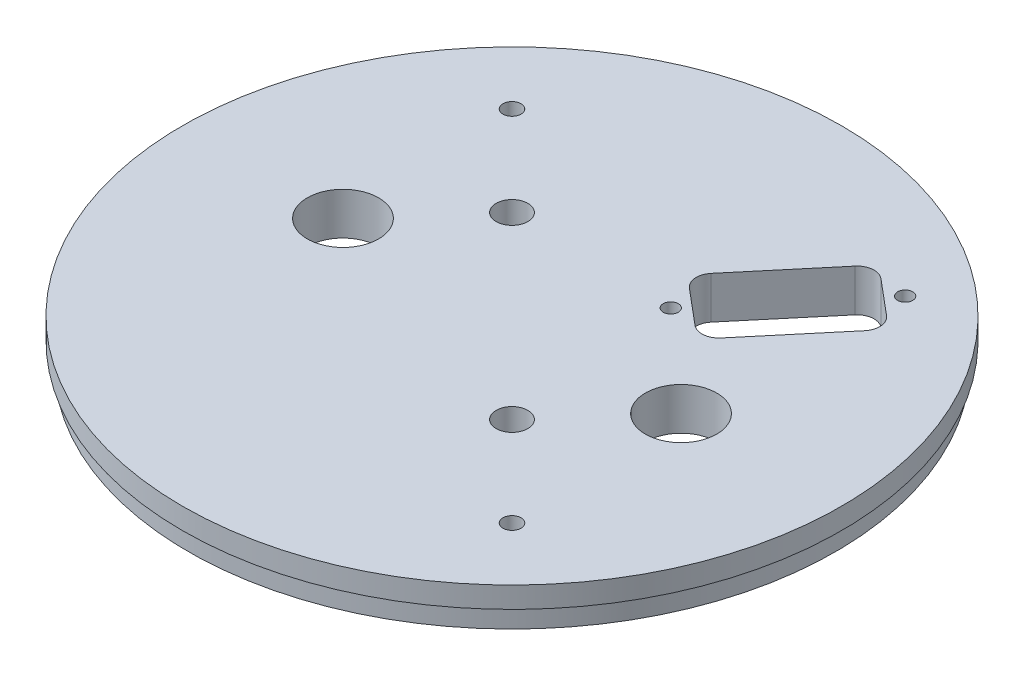
from build123d import *

# Parameters (mm, degrees)
SKETCH1_R                 = 49.5173
SKETCH1_R_2               = 5.3578125
SKETCH1_R_3               = 1.3589
SKETCH1_R_4               = 2.38125
BOSS_EXTRUDE1_DEPTH       = 6.35
SKETCH2_R                 = 49.5173
SKETCH2_R_2               = 48.641
CUT_EXTRUDE1_DEPTH        = 3.175
CUT_EXTRUDE2_START        = -5.969
CUT_EXTRUDE2_DEPTH        = 3.556
TAP_DRILL_FOR_4_40_TAP1_D = 2.2606
CUT_EXTRUDE3_DEPTH        = 71.315350377


with BuildPart() as part:
    # Sketch1 → Boss-Extrude1 (new body)
    with BuildSketch(Plane(origin=(0, 0, 0), x_dir=(1, 0, 0), z_dir=(0, 1, 0))):
        Circle(SKETCH1_R)
        with Locations((25.4, 0)):
            Circle(SKETCH1_R_2, mode=Mode.SUBTRACT)
        with Locations((-25.4, 0)):
            Circle(SKETCH1_R_2, mode=Mode.SUBTRACT)
        with Locations((-26.940768363, 26.940768363)):
            Circle(SKETCH1_R_3, mode=Mode.SUBTRACT)
        with Locations((26.940768363, -26.940768363)):
            Circle(SKETCH1_R_3, mode=Mode.SUBTRACT)
        with Locations((-13.470384182, 13.470384182)):
            Circle(SKETCH1_R_4, mode=Mode.SUBTRACT)
        with Locations((13.470384182, -13.470384182)):
            Circle(SKETCH1_R_4, mode=Mode.SUBTRACT)
    extrude(amount=BOSS_EXTRUDE1_DEPTH)

    # Sketch2 → Cut-Extrude1 (cut)
    with BuildSketch(Plane.XZ):
        Circle(SKETCH2_R)
        Circle(SKETCH2_R_2, mode=Mode.SUBTRACT)
    extrude(amount=-CUT_EXTRUDE1_DEPTH, mode=Mode.SUBTRACT)

    # Sketch3 → Cut-Extrude2 (cut)
    with BuildSketch(Plane(origin=(0, 6.35, 0), x_dir=(1, 0, 0), z_dir=(0, 1, 0)).offset(CUT_EXTRUDE2_START)):
        with BuildLine():
            Line((3.2385, 34.798), (3.2385, 13.97))
            ThreePointArc((3.2385, 13.97), (0, 10.7315), (-3.2385, 13.97))
            Line((-3.2385, 13.97), (-3.2385, 34.798))
            ThreePointArc((-3.2385, 34.798), (0, 38.0365), (3.2385, 34.798))
        make_face()
        with BuildLine():
            Line((3.2385, -34.798), (3.2385, -13.97))
            ThreePointArc((3.2385, -13.97), (0, -10.7315), (-3.2385, -13.97))
            Line((-3.2385, -13.97), (-3.2385, -34.798))
            ThreePointArc((-3.2385, -34.798), (0, -38.0365), (3.2385, -34.798))
        make_face()
    extrude(amount=-CUT_EXTRUDE2_DEPTH, mode=Mode.SUBTRACT)

    # Tap Drill for #4-40 Tap1 (through all)
    with Locations(Plane(origin=(0, 6.35, 0), x_dir=(1, 0, 0), z_dir=(0, 1, 0))):
        with Locations((10.884536857, 12.971685903), (26.954227124, 32.122797011)):
            Hole(TAP_DRILL_FOR_4_40_TAP1_D / 2)

    # Sketch4 → Cut-Extrude3 (cut, through all)
    with BuildSketch(Plane(origin=(0, 6.35, 0), x_dir=(1, 0, 0), z_dir=(0, 1, 0))):
        with BuildLine():
            Line((9.727182938, 16.926982214), (14.980715729, 12.518744787))
            ThreePointArc((14.980715729, 12.518744787), (16.834771844, 11.934163139), (18.559149143, 12.831817144))
            Line((18.559149143, 12.831817144), (28.424653401, 24.589067286))
            ThreePointArc((28.424653401, 24.589067286), (29.009235048, 26.443123401), (28.111581044, 28.1675007))
            Line((28.111581044, 28.1675007), (22.858048253, 32.575738127))
            ThreePointArc((22.858048253, 32.575738127), (21.003992138, 33.160319775), (19.279614839, 32.26266577))
            Line((19.279614839, 32.26266577), (9.414110581, 20.505415628))
            ThreePointArc((9.414110581, 20.505415628), (8.829528933, 18.651359513), (9.727182938, 16.926982214))
        make_face()
    extrude(amount=-CUT_EXTRUDE3_DEPTH, mode=Mode.SUBTRACT)


solid = part.part
